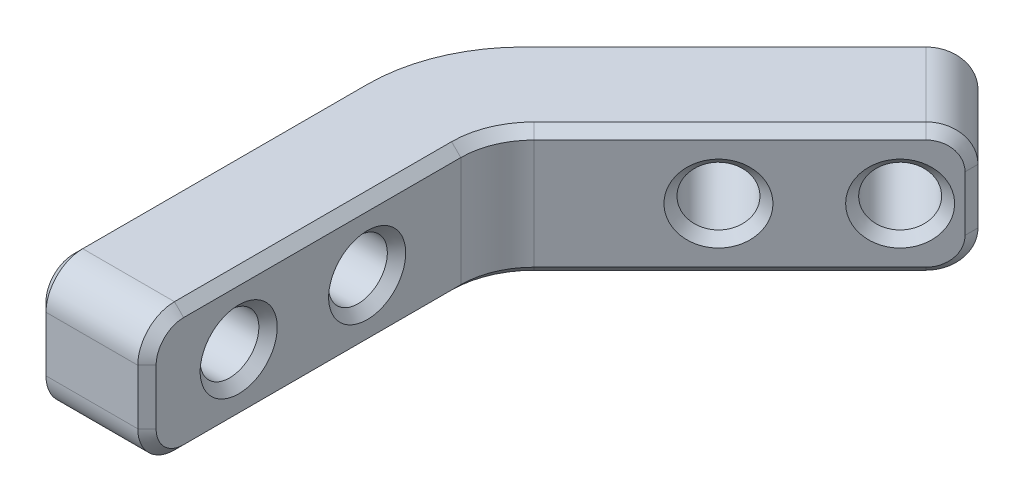
from build123d import *

# Parameters (mm, degrees)
BOSS_EXTRUDE1_DEPTH = 8.89
SKETCH2_R           = 2.032
CUT_EXTRUDE1_DEPTH  = 32.747949244
CUT_EXTRUDE2_REACH  = 32.77
SKETCH3_R           = 2.032
FILLET1_R           = 2.54
FILLET2_R           = 5.08
FILLET3_R           = 11.43
CHAMFER1_SIZE       = 0.635


with BuildPart() as part:
    # Sketch1 → Boss-Extrude1 (new body)
    with BuildSketch(Plane(origin=(0, 0, 0), x_dir=(1, 0, 0), z_dir=(0, 1, 0))):
        Polygon((3.81, -1.578153673), (3.81, -25.4), (-3.81, -25.4), (-3.81, 1.578153673), (15.266435406, 20.654589078), (20.654589078, 15.266435406), align=None)
    extrude(amount=BOSS_EXTRUDE1_DEPTH)

    # Sketch2 → Cut-Extrude1 (cut, through all)
    with BuildSketch(Plane(origin=(3.81, 0, 0), x_dir=(0, 0, -1), z_dir=(1, 0, 0))):
        with Locations((-19.05, 4.445)):
            Circle(SKETCH2_R)
        with Locations((-10.16, 4.445)):
            Circle(SKETCH2_R)
    extrude(amount=-CUT_EXTRUDE1_DEPTH, mode=Mode.SUBTRACT)

    # Sketch3 → Cut-Extrude2 (cut, up to next)
    with BuildSketch(Plane(origin=(2.694076836, 0, 2.694076836), x_dir=(0.7071067811865475, 0, -0.7071067811865477), z_dir=(0.7071067811865477, 0, 0.7071067811865475)), mode=Mode.PRIVATE) as cut_extrude2_sk1:
        with Locations((21.59, 4.445)):
            Circle(SKETCH3_R)
    cut_extrude2_tool1 = extrude(cut_extrude2_sk1.sketch, amount=-CUT_EXTRUDE2_REACH, mode=Mode.PRIVATE) & part.part
    # Sketch3 → Cut-Extrude2 (cut, up to next)
    with BuildSketch(Plane(origin=(2.694076836, 0, 2.694076836), x_dir=(0.7071067811865475, 0, -0.7071067811865477), z_dir=(0.7071067811865477, 0, 0.7071067811865475)), mode=Mode.PRIVATE) as cut_extrude2_sk2:
        with Locations((12.7, 4.445)):
            Circle(SKETCH3_R)
    cut_extrude2_tool2 = extrude(cut_extrude2_sk2.sketch, amount=-CUT_EXTRUDE2_REACH, mode=Mode.PRIVATE) & part.part
    add(cut_extrude2_tool1.solids().sort_by_distance((17.960512, 4.445, -12.572359))[0], mode=Mode.SUBTRACT)
    add(cut_extrude2_tool2.solids().sort_by_distance((11.674333, 4.445, -6.286179))[0], mode=Mode.SUBTRACT)

    # Fillet1
    fillet1_edges = [part.edges().sort_by_distance(p)[0] for p in [
        (17.960512242, 0, -17.960512242),
        (17.960512242, 8.89, -17.960512242),
        (0, 0, 25.4),
        (0, 8.89, 25.4),
    ]]
    fillet(fillet1_edges, radius=FILLET1_R)

    # Fillet2
    fillet2_edges = [part.edges().sort_by_distance(p)[0] for p in [
        (3.81, 4.445, 1.578153673),
    ]]
    fillet(fillet2_edges, radius=FILLET2_R)

    # Fillet3
    fillet3_edges = [part.edges().sort_by_distance(p)[0] for p in [
        (-3.81, 4.445, -1.578153673),
    ]]
    fillet(fillet3_edges, radius=FILLET3_R)

    # Chamfer1
    chamfer1_edges = [part.edges().sort_by_distance(p)[0] for p in [
        (11.13551759, 4.445, -16.523671263),
        (4.849338305, 4.445, -10.237491978),
        (-3.81, 4.445, 21.082),
        (-3.81, 4.445, 12.192),
        (-2.939943057, 8.89, -1.217764287),
        (6.504076836, 8.89, -11.892230509),
        (14.740384182, 8.146051224, -20.128537854),
        (15.266435406, 4.445, -20.654589078),
        (14.740384182, 0.743948776, -20.128537854),
        (-3.81, 8.89, 13.008153673),
        (-3.81, 8.146051224, 24.656051224),
        (-3.81, 4.445, 25.4),
        (-3.81, 0.743948776, 24.656051224),
        (6.504076836, 0, -11.892230509),
        (-2.939943057, 0, -1.217764287),
        (-3.81, 0, 13.008153673),
        (3.81, 4.445, 21.082),
        (3.81, 4.445, 12.192),
        (4.196691975, 8.89, 1.738326733),
        (3.81, 8.89, 13.271179285),
        (3.81, 8.146051224, 24.656051224),
        (3.81, 4.445, 25.4),
        (3.81, 0.743948776, 24.656051224),
        (3.81, 0, 13.271179285),
        (4.196691975, 0, 1.738326733),
        (12.078217703, 0, -6.69006403),
        (20.128537854, 0.743948776, -14.740384182),
        (20.654589078, 4.445, -15.266435406),
        (20.128537854, 8.146051224, -14.740384182),
        (12.078217703, 8.89, -6.69006403),
        (16.523671263, 4.445, -11.13551759),
        (10.237491978, 4.445, -4.849338305),
    ]]
    chamfer(chamfer1_edges, length=CHAMFER1_SIZE)


solid = part.part
